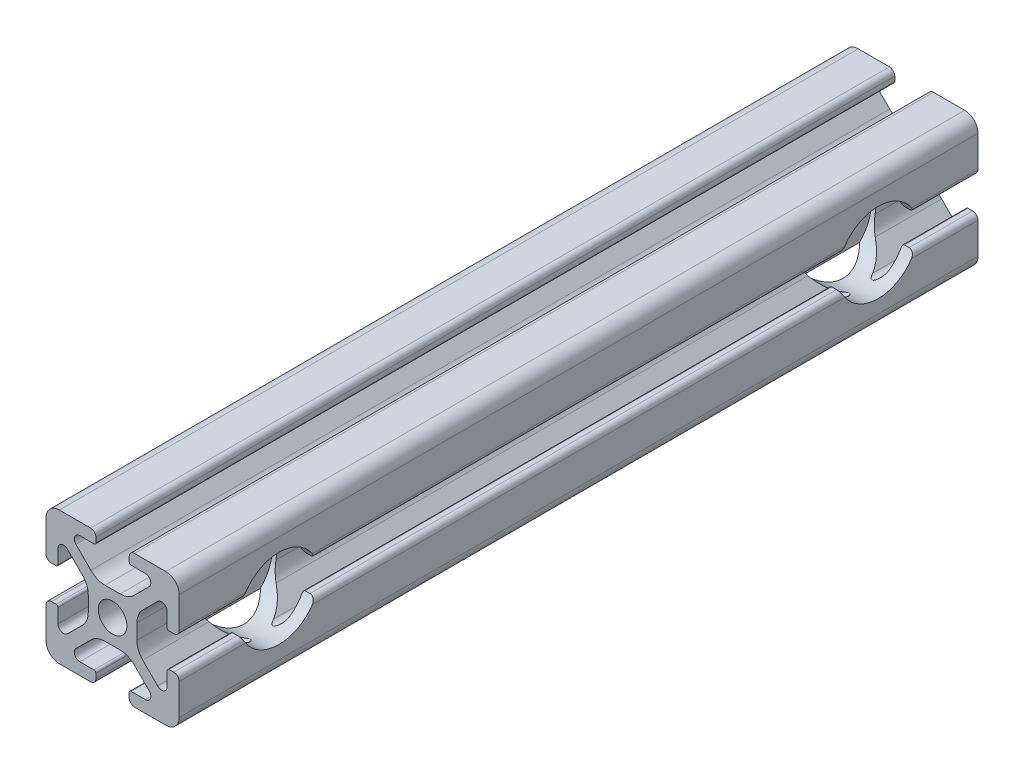
from build123d import *

# Parameters (mm, degrees)
BOSS_EXTRU_1_DEPTH      = 120
ESQUISSE2_R             = 6
ENL_V_MAT_EXTRU_1_DEPTH = 7
ESQUISSE3_R             = 2.5
ENL_V_MAT_EXTRU_2_DEPTH = 122.115647313


with BuildPart() as part:
    # Esquisse1 → Boss.-Extru.1 (new body)
    with BuildSketch(Plane.XY):
        with BuildLine():
            Line((-3.255887446, 4.528679645), (-5.506192286, 6.778984485))
            ThreePointArc((-5.506192286, 6.778984485), (-5.686636441, 7.686138511), (-4.917588391, 8.199999989))
            Line((-4.917588391, 8.199999989), (-2.799999991, 8.199999989))
            ThreePointArc((-2.799999991, 8.199999989), (-2.587867957, 8.287867955), (-2.499999991, 8.499999989))
            Line((-2.499999991, 8.499999989), (-2.499999991, 9.199999989))
            ThreePointArc((-2.499999991, 9.199999989), (-2.734314566, 9.765685414), (-3.299999991, 9.999999989))
            Line((-3.299999991, 9.999999989), (-7.999999991, 9.999999989))
            ThreePointArc((-7.999999991, 9.999999989), (-9.414213554, 9.414213552), (-9.999999991, 7.999999989))
            Line((-9.999999991, 7.999999989), (-9.999999991, 3.299999989))
            ThreePointArc((-9.999999991, 3.299999989), (-9.765685416, 2.734314564), (-9.199999991, 2.499999989))
            Line((-9.199999991, 2.499999989), (-8.499999991, 2.499999989))
            ThreePointArc((-8.499999991, 2.499999989), (-8.287867957, 2.587867955), (-8.199999991, 2.799999989))
            Line((-8.199999991, 2.799999989), (-8.199999991, 4.917588389))
            ThreePointArc((-8.199999991, 4.917588389), (-7.686138517, 5.686636433), (-6.778984497, 5.506192279))
            Line((-6.778984497, 5.506192279), (-4.528679657, 3.255887439))
            ThreePointArc((-4.528679657, 3.255887439), (-3.878361403, 2.282617393), (-3.650000001, 1.134567096))
            Line((-3.650000001, 1.134567096), (-3.650000001, -1.134567114))
            ThreePointArc((-3.650000001, -1.134567114), (-3.878361403, -2.282617409), (-4.528679656, -3.255887454))
            Line((-4.528679656, -3.255887454), (-6.778984496, -5.506192294))
            ThreePointArc((-6.778984496, -5.506192294), (-7.686138522, -5.686636449), (-8.2, -4.9175884))
            Line((-8.2, -4.9175884), (-8.2, -2.8))
            ThreePointArc((-8.2, -2.8), (-8.287867966, -2.587867966), (-8.5, -2.5))
            Line((-8.5, -2.5), (-9.2, -2.5))
            ThreePointArc((-9.2, -2.5), (-9.765685425, -2.734314575), (-10, -3.3))
            Line((-10, -3.3), (-10, -8))
            ThreePointArc((-10, -8), (-9.414213562, -9.414213562), (-8, -10))
            Line((-8, -10), (-3.3, -10))
            ThreePointArc((-3.3, -10), (-2.734314575, -9.765685425), (-2.5, -9.2))
            Line((-2.5, -9.2), (-2.5, -8.5))
            ThreePointArc((-2.5, -8.5), (-2.587867966, -8.287867966), (-2.8, -8.2))
            Line((-2.8, -8.2), (-4.9175884, -8.2))
            ThreePointArc((-4.9175884, -8.2), (-5.686636444, -7.686138526), (-5.50619229, -6.778984506))
            Line((-5.50619229, -6.778984506), (-3.25588745, -4.528679666))
            ThreePointArc((-3.25588745, -4.528679666), (-2.282617404, -3.878361412), (-1.134567106, -3.650000009))
            Line((-1.134567106, -3.650000009), (1.134567104, -3.650000009))
            ThreePointArc((1.134567104, -3.650000009), (2.282617399, -3.878361412), (3.255887444, -4.528679664))
            Line((3.255887444, -4.528679664), (5.506192284, -6.778984504))
            ThreePointArc((5.506192284, -6.778984504), (5.686636439, -7.686138531), (4.917588389, -8.200000009))
            Line((4.917588389, -8.200000009), (2.799999989, -8.200000009))
            ThreePointArc((2.799999989, -8.200000009), (2.587867955, -8.287867974), (2.499999989, -8.500000009))
            Line((2.499999989, -8.500000009), (2.499999989, -9.200000009))
            ThreePointArc((2.499999989, -9.200000009), (2.734314564, -9.765685434), (3.299999989, -10.000000009))
            Line((3.299999989, -10.000000009), (7.999999989, -10.000000009))
            ThreePointArc((7.999999989, -10.000000009), (9.414213552, -9.414213571), (9.999999989, -8.000000009))
            Line((9.999999989, -8.000000009), (9.999999989, -3.300000009))
            ThreePointArc((9.999999989, -3.300000009), (9.765685414, -2.734314584), (9.199999989, -2.500000009))
            Line((9.199999989, -2.500000009), (8.499999989, -2.500000009))
            ThreePointArc((8.499999989, -2.500000009), (8.287867955, -2.587867974), (8.199999989, -2.800000009))
            Line((8.199999989, -2.800000009), (8.199999989, -4.917588409))
            ThreePointArc((8.199999989, -4.917588409), (7.686138515, -5.686636452), (6.778984495, -5.506192299))
            Line((6.778984495, -5.506192299), (4.528679655, -3.255887459))
            ThreePointArc((4.528679655, -3.255887459), (3.878361401, -2.282617412), (3.649999999, -1.134567115))
            Line((3.649999999, -1.134567115), (3.649999999, 1.134567095))
            ThreePointArc((3.649999999, 1.134567095), (3.878361401, 2.28261739), (4.528679654, 3.255887435))
            Line((4.528679654, 3.255887435), (6.778984494, 5.506192275))
            ThreePointArc((6.778984494, 5.506192275), (7.68613852, 5.68663643), (8.199999998, 4.917588381))
            Line((8.199999998, 4.917588381), (8.199999998, 2.799999981))
            ThreePointArc((8.199999998, 2.799999981), (8.287867964, 2.587867946), (8.499999998, 2.499999981))
            Line((8.499999998, 2.499999981), (9.199999998, 2.499999981))
            ThreePointArc((9.199999998, 2.499999981), (9.765685423, 2.734314556), (9.999999998, 3.299999981))
            Line((9.999999998, 3.299999981), (9.999999998, 7.999999981))
            ThreePointArc((9.999999998, 7.999999981), (9.41421356, 9.414213543), (7.999999998, 9.999999981))
            Line((7.999999998, 9.999999981), (3.299999998, 9.999999981))
            ThreePointArc((3.299999998, 9.999999981), (2.734314573, 9.765685406), (2.499999998, 9.199999981))
            Line((2.499999998, 9.199999981), (2.499999998, 8.499999981))
            ThreePointArc((2.499999998, 8.499999981), (2.587867964, 8.287867946), (2.799999998, 8.199999981))
            Line((2.799999998, 8.199999981), (4.917588398, 8.199999981))
            ThreePointArc((4.917588398, 8.199999981), (5.686636442, 7.686138507), (5.506192288, 6.778984487))
            Line((5.506192288, 6.778984487), (3.255887448, 4.528679647))
            ThreePointArc((3.255887448, 4.528679647), (2.282617402, 3.878361393), (1.134567104, 3.64999999))
            Line((1.134567104, 3.64999999), (-1.134567106, 3.64999999))
            ThreePointArc((-1.134567106, 3.64999999), (-2.282617401, 3.878361392), (-3.255887446, 4.528679645))
        make_face()
        with BuildLine():
            ThreePointArc((-2.15, 0), (0, -2.15), (2.15, 0))
            ThreePointArc((2.15, 0), (0, 2.15), (-2.15, 0))
        make_face(mode=Mode.SUBTRACT)
    extrude(amount=BOSS_EXTRU_1_DEPTH)

    # Esquisse2 → Enlèv. mat.-Extru.1 (cut)
    with BuildSketch(Plane(origin=(9.999999998, 0, 0), x_dir=(0, 0, -1), z_dir=(1, 0, 0))):
        with Locations((-105, 0)):
            Circle(ESQUISSE2_R)
        with Locations((-15, 0)):
            Circle(ESQUISSE2_R)
    extrude(amount=-ENL_V_MAT_EXTRU_1_DEPTH, mode=Mode.SUBTRACT)

    # Esquisse3 → Enlèv. mat.-Extru.2 (cut, through all)
    with BuildSketch(Plane(origin=(2.999999998, 0, 0), x_dir=(0, 0, -1), z_dir=(1, 0, 0))):
        with Locations((-105, 0)):
            Circle(ESQUISSE3_R)
        with Locations((-15, 0)):
            Circle(ESQUISSE3_R)
    extrude(amount=-ENL_V_MAT_EXTRU_2_DEPTH, mode=Mode.SUBTRACT)


solid = part.part
